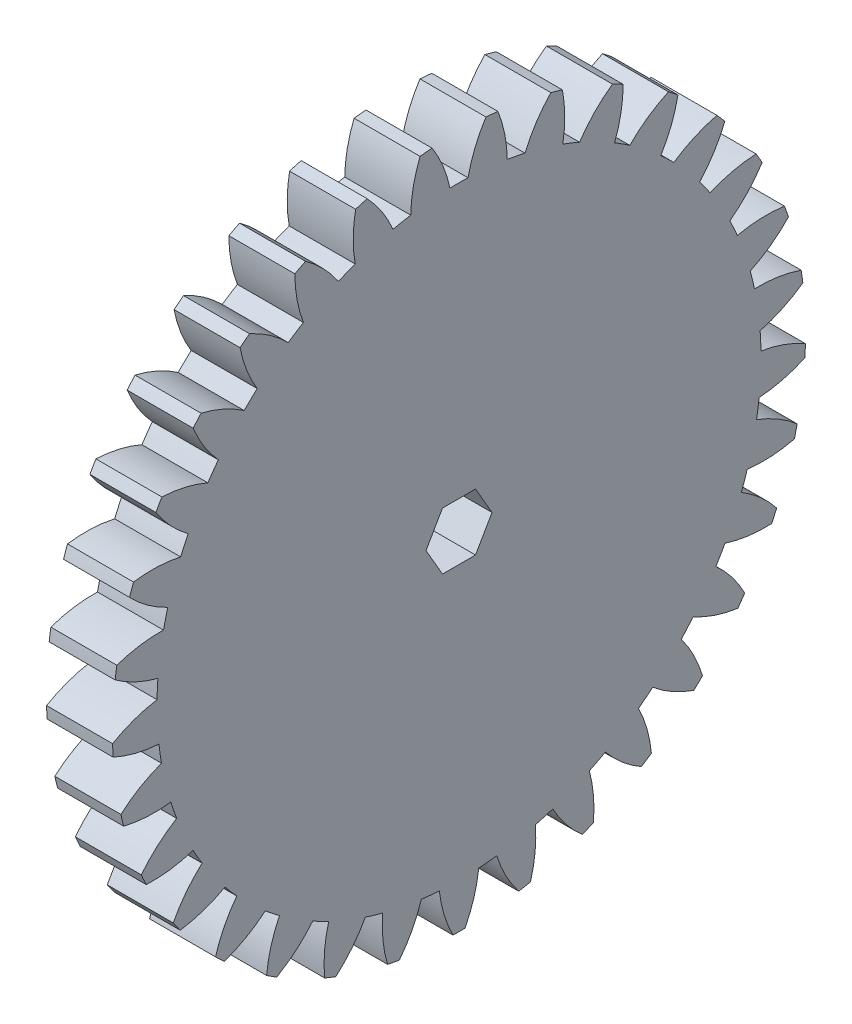
from build123d import *

# Parameters (mm, degrees)
BASPROSKE_W         = 5
BASPROSKE_H         = 26.25
TOOTHCUT_DEPTH      = 38.458310159
TEETHCUTS_COUNT     = 33
TEETHCUTS_ANGLE     = 349.090909091
BORE_DEPTH          = 50.0000508
BOSS_EXTRUDE1_DEPTH = 6


with BuildPart() as part:
    # BasProSke → Base-Revolve (revolve)
    with BuildSketch(Plane(origin=(0, 0, 0), x_dir=(1, 0, 0), z_dir=(0, 1, 0))):
        with Locations((2.5, 13.125)):
            Rectangle(BASPROSKE_W, BASPROSKE_H)
    revolve(axis=Axis((-10, 0, 0), (1, 0, 0)))

    # TooCutSke → ToothCut (cut, through all)
    with BuildSketch(Plane(origin=(0, 0, 0), x_dir=(0, 0, -1), z_dir=(1, 0, 0))):
        with BuildLine():
            ThreePointArc((0.683690741, 22.863780155), (0, 22.874), (-0.683690741, 22.863780155))
            ThreePointArc((-0.683690741, 22.863780155), (-1.217783987, 24.592276227), (-2.057504394, 26.194719331))
            ThreePointArc((-2.057504394, 26.194719331), (0, 26.2754), (2.057504394, 26.194719331))
            ThreePointArc((2.057504394, 26.194719331), (1.217783987, 24.592276227), (0.683690741, 22.863780155))
        make_face()
    toothcut = extrude(amount=TOOTHCUT_DEPTH, mode=Mode.SUBTRACT)

    # TeethCuts: ToothCut ×33 about axis
    teethcuts_axis = Axis((-10, 0, 0), (1, 0, 0))
    for i in range(1, TEETHCUTS_COUNT):
        add(toothcut.rotate(teethcuts_axis, i * TEETHCUTS_ANGLE / (TEETHCUTS_COUNT - 1)), mode=Mode.SUBTRACT)

    # BorSke → Bore (cut, symmetric)
    with BuildSketch(Plane(origin=(0, 0, 0), x_dir=(0, 0, -1), z_dir=(1, 0, 0))):
        Polygon((-2.5, 0), (-1.25, -2.165063509), (1.25, -2.165063509), (2.5, 0), (1.25, 2.165063509), (-1.25, 2.165063509), align=None)
    extrude(amount=BORE_DEPTH, both=True, mode=Mode.SUBTRACT)

    # Sketch1 → Boss-Extrude1 (add)
    with BuildSketch(Plane.ZY):
        with BuildLine():
            ThreePointArc((0.186825141, -8.9980607), (1.087459563, -7.388027907), (0.875696031, -5.555405697))
            ThreePointArc((0.875696031, -5.555405697), (1.737911576, -5.348741848), (2.556932568, -5.009138832))
            ThreePointArc((2.556932568, -5.009138832), (3.46280058, -6.616232826), (5.137782665, -7.389397086))
            ThreePointArc((5.137782665, -7.389397086), (5.290067271, -7.281152949), (5.440072093, -7.16977096))
            ThreePointArc((5.440072093, -7.16977096), (5.222347115, -5.337847438), (3.97383851, -3.979696407))
            ThreePointArc((3.97383851, -3.979696407), (4.549911576, -3.305704259), (5.012899834, -2.549551188))
            ThreePointArc((5.012899834, -2.549551188), (6.690388598, -3.317261682), (8.49993212, -2.958234941))
            ThreePointArc((8.49993212, -2.958234941), (8.559508647, -2.781152949), (8.615396407, -2.602872405))
            ThreePointArc((8.615396407, -2.602872405), (7.362475569, -1.248790674), (5.554109745, -0.883878355))
            ThreePointArc((5.554109745, -0.883878355), (5.624, 0), (5.554109745, 0.883878355))
            ThreePointArc((5.554109745, 0.883878355), (7.362475569, 1.248790674), (8.615396407, 2.602872405))
            ThreePointArc((8.615396407, 2.602872405), (8.559508647, 2.781152949), (8.49993212, 2.958234941))
            ThreePointArc((8.49993212, 2.958234941), (6.690388598, 3.317261682), (5.012899834, 2.549551188))
            ThreePointArc((5.012899834, 2.549551188), (4.549911576, 3.305704259), (3.97383851, 3.979696407))
            ThreePointArc((3.97383851, 3.979696407), (5.222347115, 5.337847438), (5.440072093, 7.16977096))
            ThreePointArc((5.440072093, 7.16977096), (5.290067271, 7.281152949), (5.137782665, 7.389397086))
            ThreePointArc((5.137782665, 7.389397086), (3.46280058, 6.616232826), (2.556932568, 5.009138832))
            ThreePointArc((2.556932568, 5.009138832), (1.737911576, 5.348741848), (0.875696031, 5.555405697))
            ThreePointArc((0.875696031, 5.555405697), (1.087459563, 7.388027907), (0.186825141, 8.9980607))
            ThreePointArc((0.186825141, 8.9980607), (0, 9), (-0.186825141, 8.9980607))
            ThreePointArc((-0.186825141, 8.9980607), (-1.087459563, 7.388027907), (-0.875696031, 5.555405697))
            ThreePointArc((-0.875696031, 5.555405697), (-1.737911576, 5.348741848), (-2.556932568, 5.009138832))
            ThreePointArc((-2.556932568, 5.009138832), (-3.46280058, 6.616232826), (-5.137782665, 7.389397086))
            ThreePointArc((-5.137782665, 7.389397086), (-5.290067271, 7.281152949), (-5.440072093, 7.16977096))
            ThreePointArc((-5.440072093, 7.16977096), (-5.222347115, 5.337847438), (-3.97383851, 3.979696407))
            ThreePointArc((-3.97383851, 3.979696407), (-4.549911576, 3.305704259), (-5.012899834, 2.549551188))
            ThreePointArc((-5.012899834, 2.549551188), (-6.690388598, 3.317261682), (-8.49993212, 2.958234941))
            ThreePointArc((-8.49993212, 2.958234941), (-8.559508647, 2.781152949), (-8.615396407, 2.602872405))
            ThreePointArc((-8.615396407, 2.602872405), (-7.362475569, 1.248790674), (-5.554109745, 0.883878355))
            ThreePointArc((-5.554109745, 0.883878355), (-5.624, 0), (-5.554109745, -0.883878355))
            ThreePointArc((-5.554109745, -0.883878355), (-7.362475569, -1.248790674), (-8.615396407, -2.602872405))
            ThreePointArc((-8.615396407, -2.602872405), (-8.559508647, -2.781152949), (-8.49993212, -2.958234941))
            ThreePointArc((-8.49993212, -2.958234941), (-6.690388598, -3.317261682), (-5.012899834, -2.549551188))
            ThreePointArc((-5.012899834, -2.549551188), (-4.549911576, -3.305704259), (-3.97383851, -3.979696407))
            ThreePointArc((-3.97383851, -3.979696407), (-5.222347115, -5.337847438), (-5.440072093, -7.16977096))
            ThreePointArc((-5.440072093, -7.16977096), (-5.290067271, -7.281152949), (-5.137782665, -7.389397086))
            ThreePointArc((-5.137782665, -7.389397086), (-3.46280058, -6.616232826), (-2.556932568, -5.009138832))
            ThreePointArc((-2.556932568, -5.009138832), (-1.737911576, -5.348741848), (-0.875696031, -5.555405697))
            ThreePointArc((-0.875696031, -5.555405697), (-1.087459563, -7.388027907), (-0.186825141, -8.9980607))
            ThreePointArc((-0.186825141, -8.9980607), (0, -9), (0.186825141, -8.9980607))
        make_face()
        Polygon((2.5, 0), (1.25, 2.165063509), (-1.25, 2.165063509), (-2.5, 0), (-1.25, -2.165063509), (1.25, -2.165063509), align=None, mode=Mode.SUBTRACT)
    extrude(amount=BOSS_EXTRUDE1_DEPTH)


solid = part.part
